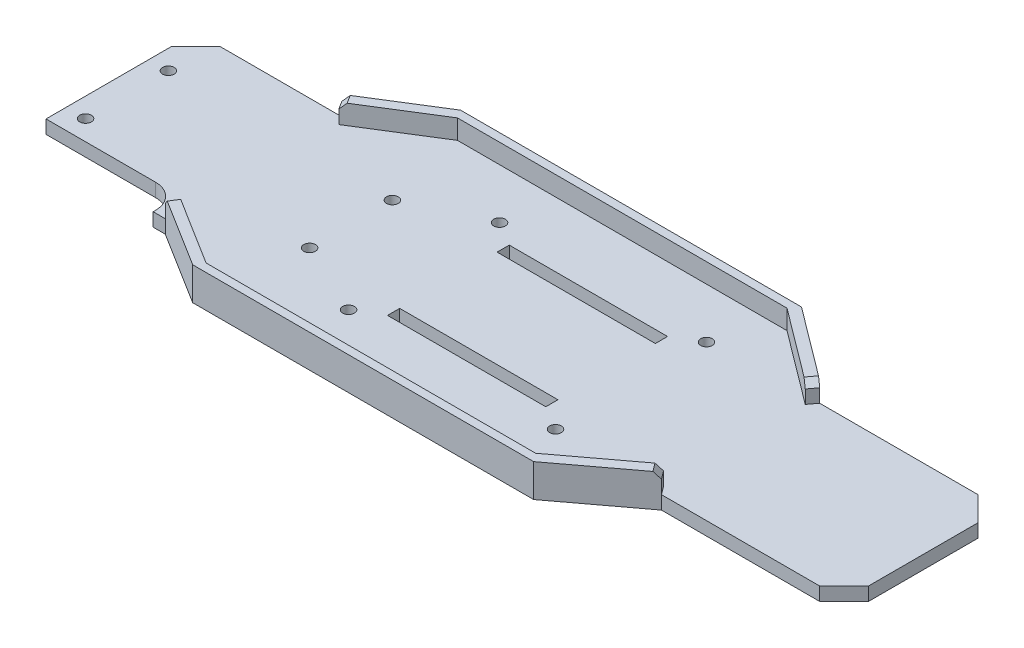
from build123d import *

# Parameters (mm, degrees)
BOSS_EXTRUDE1_DEPTH  = 5.5
CHASSIS_WALLS1_DEPTH = 8
CHAMFER1_SIZE        = 10
CHAMFER2_SIZE        = 10
CHAMFER3_SIZE        = 2.5
SKETCH4_R            = 2.4
CUT_EXTRUDE1_DEPTH   = 10
SKETCH5_W            = 55
SKETCH5_H            = 11
CUT_EXTRUDE2_DEPTH   = 10
SKETCH6_W            = 65
SKETCH6_H            = 5
CUT_EXTRUDE3_DEPTH   = 184.613724977
FILLET1_R            = 10


with BuildPart() as part:
    # Sketch1 → Boss-Extrude1 (new body)
    with BuildSketch(Plane(origin=(0, 0, 0), x_dir=(1, 0, 0), z_dir=(0, 1, 0))):
        Polygon((-100, 36.25), (-70, 55), (70, 55), (100, 32.5), (175, 32.5), (175, -32.5), (100, -32.5), (70, -55), (-70, -55), (-100, -36.25), (-160, -36.25), (-160, 36.25), align=None)
    extrude(amount=BOSS_EXTRUDE1_DEPTH)

    # Sketch3 → Chassis-Walls1 (add)
    with BuildSketch(Plane(origin=(0, 5.5, 0), x_dir=(1, 0, 0), z_dir=(0, 1, 0))):
        Polygon((0, 55), (-70, 55), (-100, 36.25), (-97.88000424, 32.858006784), (-67.88000424, 51.608006784), (0, 51.608006784), (67.456005088, 51.608006784), (97.456005088, 29.108006784), (100, 32.5), (70, 55), align=None)
        Polygon((67.456005088, -51.608006784), (0, -51.608006784), (-67.88000424, -51.608006784), (-97.88000424, -32.858006784), (-100, -36.25), (-70, -55), (0, -55), (70, -55), (100, -32.5), (97.456005088, -29.108006784), align=None)
    extrude(amount=CHASSIS_WALLS1_DEPTH)

    # Chamfer1
    chamfer1_edges = [part.edges().sort_by_distance(p)[0] for p in [
        (-160, 2.75, -36.25),
        (-160, 2.75, 36.25),
    ]]
    chamfer(chamfer1_edges, length=CHAMFER1_SIZE)

    # Chamfer2
    chamfer2_edges = [part.edges().sort_by_distance(p)[0] for p in [
        (175, 2.75, -32.5),
        (175, 2.75, 32.5),
    ]]
    chamfer(chamfer2_edges, length=CHAMFER2_SIZE)

    # Chamfer3
    chamfer3_edges = [part.edges().sort_by_distance(p)[0] for p in [
        (-98.94000212, 13.5, -34.554003392),
        (-98.94000212, 13.5, 34.554003392),
        (98.728002544, 13.5, 30.804003392),
        (98.728002544, 13.5, -30.804003392),
    ]]
    chamfer(chamfer3_edges, length=CHAMFER3_SIZE)

    # Sketch4 → Cut-Extrude1 (cut)
    with BuildSketch(Plane.XZ):
        with Locations((-152, 17)):
            Circle(SKETCH4_R)
        with Locations((-60, 17)):
            Circle(SKETCH4_R)
        with Locations((-60, -17)):
            Circle(SKETCH4_R)
        with Locations((-152, -17)):
            Circle(SKETCH4_R)
        with Locations((-30, 31)):
            Circle(SKETCH4_R)
        with Locations((55, 31)):
            Circle(SKETCH4_R)
        with Locations((55, -31)):
            Circle(SKETCH4_R)
        with Locations((-30, -31)):
            Circle(SKETCH4_R)
    extrude(amount=-CUT_EXTRUDE1_DEPTH, mode=Mode.SUBTRACT)

    # Sketch5 → Cut-Extrude2 (cut)
    with BuildSketch(Plane(origin=(0, 5.5, 0), x_dir=(1, 0, 0), z_dir=(0, 1, 0))):
        with Locations((-132.5, -30.75)):
            Rectangle(SKETCH5_W, SKETCH5_H)
    extrude(amount=-CUT_EXTRUDE2_DEPTH, mode=Mode.SUBTRACT)

    # Sketch6 → Cut-Extrude3 (cut, through all)
    with BuildSketch(Plane(origin=(0, 5.5, 0), x_dir=(1, 0, 0), z_dir=(0, 1, 0))):
        with Locations((12.5, 22.5)):
            Rectangle(SKETCH6_W, SKETCH6_H)
        with Locations((12.5, -22.5)):
            Rectangle(SKETCH6_W, SKETCH6_H)
    extrude(amount=-CUT_EXTRUDE3_DEPTH, mode=Mode.SUBTRACT)

    # Fillet1
    fillet1_edges = [part.edges().sort_by_distance(p)[0] for p in [
        (-105, 2.75, 25.25),
    ]]
    fillet(fillet1_edges, radius=FILLET1_R)


solid = part.part
